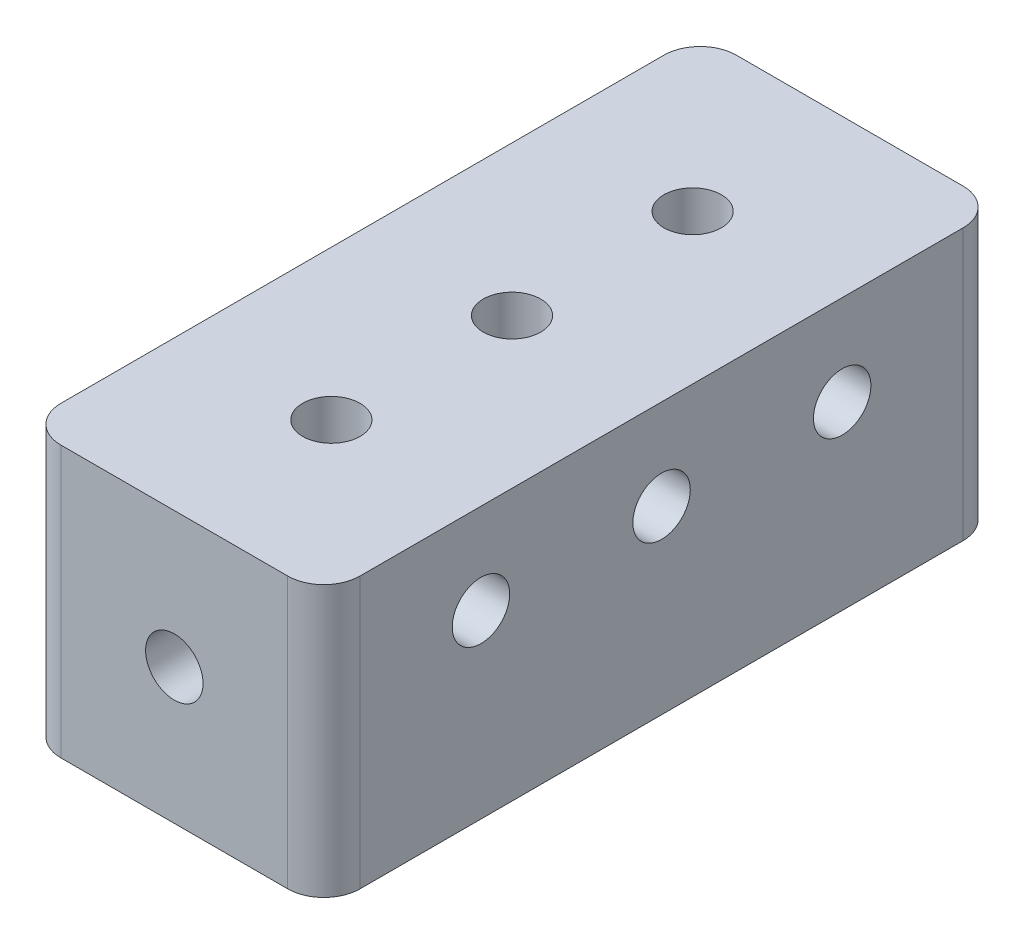
from build123d import *

# Parameters (mm, degrees)
SKETCH1_W           = 21.0312
SKETCH1_H           = 47.4853
BOSS_EXTRUDE1_DEPTH = 9.525
SKETCH2_R           = 2.0193
CUT_EXTRUDE1_DEPTH  = 9.525
CUT_EXTRUDE2_START  = -9.525
SKETCH3_R           = 2.0193
CUT_EXTRUDE2_DEPTH  = 9.525
SKETCH4_R           = 2.0193
CUT_EXTRUDE3_DEPTH  = 6.35
CUT_EXTRUDE4_START  = -6.35
SKETCH5_R           = 2.0193
CUT_EXTRUDE4_DEPTH  = 6.35
SKETCH6_R           = 2.0193
CUT_EXTRUDE5_DEPTH  = 6.35
FILLET1_R           = 2.54


with BuildPart() as part:
    # Sketch1 → Boss-Extrude1 (new, symmetric)
    with BuildSketch(Plane(origin=(0, 0, 0), x_dir=(1, 0, 0), z_dir=(0, 1, 0))):
        Rectangle(SKETCH1_W, SKETCH1_H)
    extrude(amount=BOSS_EXTRUDE1_DEPTH, both=True)

    # Sketch2 → Cut-Extrude1 (cut)
    with BuildSketch(Plane.XY.offset(23.74265)):
        Circle(SKETCH2_R)
    extrude(amount=-CUT_EXTRUDE1_DEPTH, mode=Mode.SUBTRACT)

    # Sketch3 → Cut-Extrude2 (cut)
    with BuildSketch(Plane(origin=(0, 0, -23.74265), x_dir=(-1, 0, 0), z_dir=(0, 0, -1)).offset(CUT_EXTRUDE2_START)):
        Circle(SKETCH3_R)
    extrude(amount=CUT_EXTRUDE2_DEPTH, mode=Mode.SUBTRACT)

    # Sketch4 → Cut-Extrude3 (cut)
    with BuildSketch(Plane(origin=(10.5156, 0, 0), x_dir=(0, 0, -1), z_dir=(1, 0, 0))):
        with Locations((-12.7, 3.175)):
            Circle(SKETCH4_R)
        with Locations((12.7, 3.175)):
            Circle(SKETCH4_R)
        with Locations((0, 3.175)):
            Circle(SKETCH4_R)
    extrude(amount=-CUT_EXTRUDE3_DEPTH, mode=Mode.SUBTRACT)

    # Sketch5 → Cut-Extrude4 (cut)
    with BuildSketch(Plane.ZY.offset(10.5156).offset(CUT_EXTRUDE4_START)):
        with Locations((-12.7, 3.175)):
            Circle(SKETCH5_R)
        with Locations((0, 3.175)):
            Circle(SKETCH5_R)
        with Locations((12.7, 3.175)):
            Circle(SKETCH5_R)
    extrude(amount=CUT_EXTRUDE4_DEPTH, mode=Mode.SUBTRACT)

    # Sketch6 → Cut-Extrude5 (cut)
    with BuildSketch(Plane(origin=(0, 9.525, 0), x_dir=(1, 0, 0), z_dir=(0, 1, 0))):
        with Locations((0, 12.7)):
            Circle(SKETCH6_R)
        Circle(SKETCH6_R)
        with Locations((0, -12.7)):
            Circle(SKETCH6_R)
    extrude(amount=-CUT_EXTRUDE5_DEPTH, mode=Mode.SUBTRACT)

    # Fillet1
    fillet1_edges = [part.edges().sort_by_distance(p)[0] for p in [
        (10.5156, 0, 23.74265),
        (-10.5156, 0, 23.74265),
        (-10.5156, 0, -23.74265),
        (10.5156, 0, -23.74265),
    ]]
    fillet(fillet1_edges, radius=FILLET1_R)


solid = part.part
